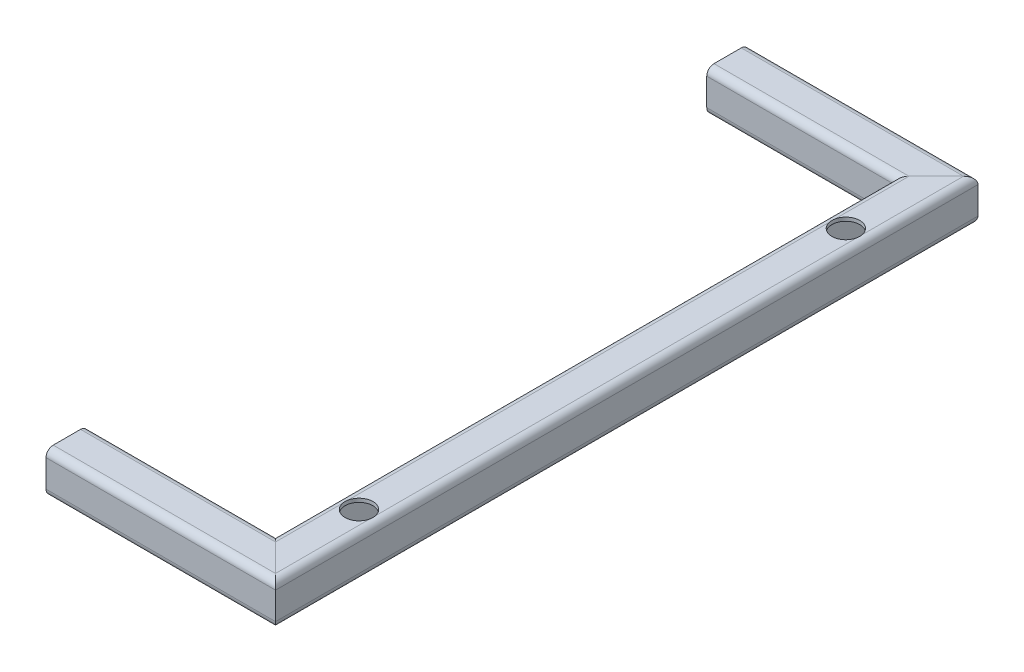
from build123d import *

# Parameters (mm, degrees)
STRUCTURAL_MEMBER1_DEPTH        = 172.213203436
STRUCTURAL_MEMBER1_2_DEPTH      = 497.213203436
STRUCTURAL_MEMBER1_2_DEPTH_BACK = 22.213203436
STRUCTURAL_MEMBER1_3_DEPTH      = 172.213203436
SKETCH12_R                      = 10
CUT_EXTRUDE1_DEPTH              = 45


with BuildPart() as part:
    # Sketch11 on segment 1 (carried to segment 1) → Structural Member1 (new body)
    with BuildSketch(Plane(origin=(-150, 0, 20.899387708), x_dir=(0, 0, -1), z_dir=(1, 0, 0))):
        with BuildLine():
            Line((-9.8, -15), (9.8, -15))
            ThreePointArc((9.8, -15), (13.476955262, -13.476955262), (15, -9.8))
            Line((15, -9.8), (15, 9.8))
            ThreePointArc((15, 9.8), (13.476955262, 13.476955262), (9.8, 15))
            Line((9.8, 15), (-9.8, 15))
            ThreePointArc((-9.8, 15), (-13.476955262, 13.476955262), (-15, 9.8))
            Line((-15, 9.8), (-15, -9.8))
            ThreePointArc((-15, -9.8), (-13.476955262, -13.476955262), (-9.8, -15))
        make_face()
        with BuildLine():
            Line((-9.8, -12.4), (9.8, -12.4))
            ThreePointArc((9.8, -12.4), (11.638477631, -11.638477631), (12.4, -9.8))
            Line((12.4, -9.8), (12.4, 9.8))
            ThreePointArc((12.4, 9.8), (11.638477631, 11.638477631), (9.8, 12.4))
            Line((9.8, 12.4), (-9.8, 12.4))
            ThreePointArc((-9.8, 12.4), (-11.638477631, 11.638477631), (-12.4, 9.8))
            Line((-12.4, 9.8), (-12.4, -9.8))
            ThreePointArc((-12.4, -9.8), (-11.638477631, -11.638477631), (-9.8, -12.4))
        make_face(mode=Mode.SUBTRACT)
    extrude(amount=STRUCTURAL_MEMBER1_DEPTH)

    # Structural Member1 mitre 1
    split(bisect_by=Plane(origin=(0, 0, 20.899387708), x_dir=(0, -1, 0), z_dir=(-0.707106781, 0, 0.707106781)), keep=Keep.TOP)


with BuildPart() as body_2:
    # Sketch11 → Structural Member1 2 (new, two sides: drawn at the far end of the back side and taken through both)
    with BuildSketch(Plane(origin=(0, 0, 20.899387708), x_dir=(-1, 0, 0), z_dir=(0, 0, -1)).offset(-STRUCTURAL_MEMBER1_2_DEPTH_BACK)):
        with BuildLine():
            Line((-9.8, -15), (9.8, -15))
            ThreePointArc((9.8, -15), (13.476955262, -13.476955262), (15, -9.8))
            Line((15, -9.8), (15, 9.8))
            ThreePointArc((15, 9.8), (13.476955262, 13.476955262), (9.8, 15))
            Line((9.8, 15), (-9.8, 15))
            ThreePointArc((-9.8, 15), (-13.476955262, 13.476955262), (-15, 9.8))
            Line((-15, 9.8), (-15, -9.8))
            ThreePointArc((-15, -9.8), (-13.476955262, -13.476955262), (-9.8, -15))
        make_face()
        with BuildLine():
            Line((-9.8, -12.4), (9.8, -12.4))
            ThreePointArc((9.8, -12.4), (11.638477631, -11.638477631), (12.4, -9.8))
            Line((12.4, -9.8), (12.4, 9.8))
            ThreePointArc((12.4, 9.8), (11.638477631, 11.638477631), (9.8, 12.4))
            Line((9.8, 12.4), (-9.8, 12.4))
            ThreePointArc((-9.8, 12.4), (-11.638477631, 11.638477631), (-12.4, 9.8))
            Line((-12.4, 9.8), (-12.4, -9.8))
            ThreePointArc((-12.4, -9.8), (-11.638477631, -11.638477631), (-9.8, -12.4))
        make_face(mode=Mode.SUBTRACT)
    extrude(amount=STRUCTURAL_MEMBER1_2_DEPTH + STRUCTURAL_MEMBER1_2_DEPTH_BACK)

    # Structural Member1 2 mitre 1
    split(bisect_by=Plane(origin=(0, 0, 20.899387708), x_dir=(0, 1, 0), z_dir=(0.707106781, 0, -0.707106781)), keep=Keep.TOP)

    # Structural Member1 2 mitre 2
    split(bisect_by=Plane(origin=(0, 0, -454.100612292), x_dir=(0, 1, 0), z_dir=(0.707106781, 0, 0.707106781)), keep=Keep.TOP)

    # Sketch12 → Cut-Extrude1 (cut)
    with BuildSketch(Plane(origin=(0, 15, 0), x_dir=(1, 0, 0), z_dir=(0, 1, 0))):
        with Locations(Location((0, 39.100612292, 0), (0, 0, 348.521659045))):
            Circle(SKETCH12_R)
        with Locations(Location((0, 389.100612292, 0), (0, 0, 348.521659045))):
            Circle(SKETCH12_R)
    extrude(amount=-CUT_EXTRUDE1_DEPTH, mode=Mode.SUBTRACT)


with BuildPart() as body_3:
    # Sketch11 on segment 3 (carried to segment 3) → Structural Member1 3 (new body)
    with BuildSketch(Plane(origin=(22.213203436, 0, -454.100612292), x_dir=(0, 0, 1), z_dir=(-1, 0, 0))):
        with BuildLine():
            Line((-9.8, -15), (9.8, -15))
            ThreePointArc((9.8, -15), (13.476955262, -13.476955262), (15, -9.8))
            Line((15, -9.8), (15, 9.8))
            ThreePointArc((15, 9.8), (13.476955262, 13.476955262), (9.8, 15))
            Line((9.8, 15), (-9.8, 15))
            ThreePointArc((-9.8, 15), (-13.476955262, 13.476955262), (-15, 9.8))
            Line((-15, 9.8), (-15, -9.8))
            ThreePointArc((-15, -9.8), (-13.476955262, -13.476955262), (-9.8, -15))
        make_face()
        with BuildLine():
            Line((-9.8, -12.4), (9.8, -12.4))
            ThreePointArc((9.8, -12.4), (11.638477631, -11.638477631), (12.4, -9.8))
            Line((12.4, -9.8), (12.4, 9.8))
            ThreePointArc((12.4, 9.8), (11.638477631, 11.638477631), (9.8, 12.4))
            Line((9.8, 12.4), (-9.8, 12.4))
            ThreePointArc((-9.8, 12.4), (-11.638477631, 11.638477631), (-12.4, 9.8))
            Line((-12.4, 9.8), (-12.4, -9.8))
            ThreePointArc((-12.4, -9.8), (-11.638477631, -11.638477631), (-9.8, -12.4))
        make_face(mode=Mode.SUBTRACT)
    extrude(amount=STRUCTURAL_MEMBER1_3_DEPTH)

    # Structural Member1 3 mitre 1
    split(bisect_by=Plane(origin=(0, 0, -454.100612292), x_dir=(0, -1, 0), z_dir=(-0.707106781, 0, -0.707106781)), keep=Keep.TOP)


solid = Compound([part.part, body_2.part, body_3.part])
